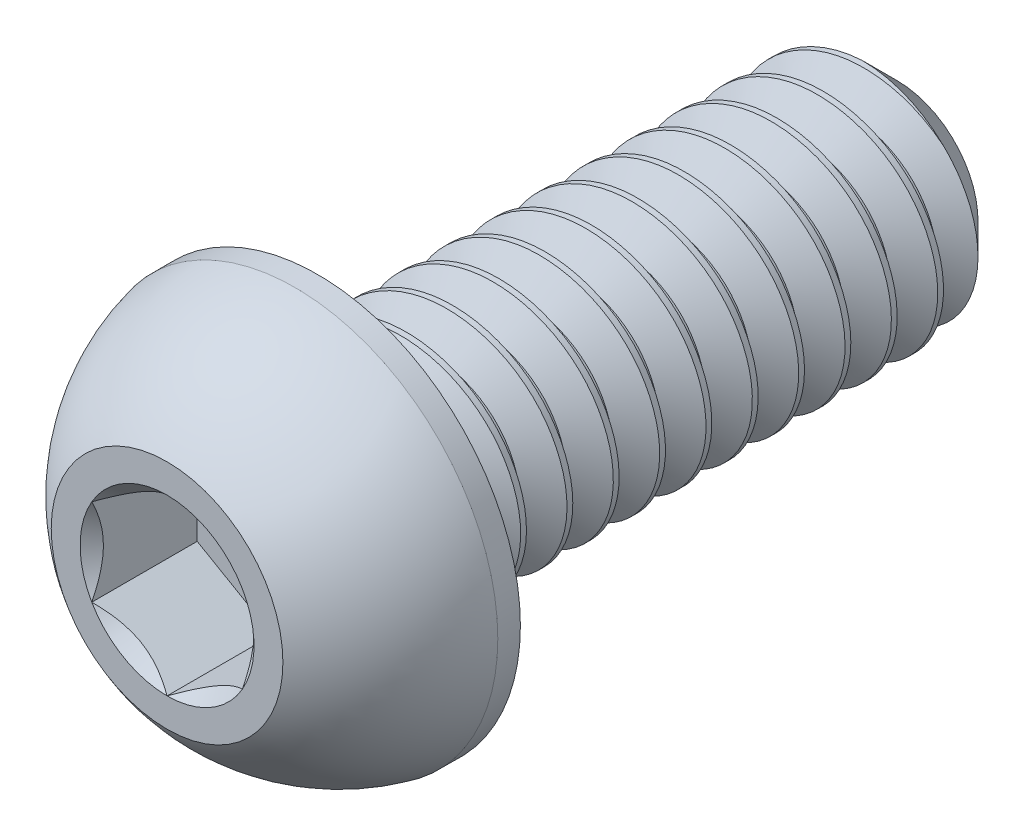
from build123d import *

# Parameters (mm, degrees)
SKETCH1_W          = 5
SKETCH1_H          = 1
CHAMFER1_SIZE      = 0.3
CUT_EXTRUDE2_DEPTH = 0.91
CUT_SWEEP1_PITCH   = 0.4
CUT_SWEEP1_TO      = 5


with BuildPart() as part:
    # Sketch1 → Revolve1 (revolve)
    with BuildSketch(Plane(origin=(0, 0, 0), x_dir=(0, 0, -1), z_dir=(1, 0, 0))):
        with Locations((3.8, 0.5)):
            Rectangle(SKETCH1_W, SKETCH1_H)
    revolve(axis=Axis((0, 0, -6.3), (0, 0, 1)))

    # Chamfer1
    chamfer1_edges = [part.edges().sort_by_distance(p)[0] for p in [
        (0, -1, -6.3),
    ]]
    chamfer(chamfer1_edges, length=CHAMFER1_SIZE)

    # Sketch7 → Revolve2 (revolve)
    with BuildSketch(Plane(origin=(0, 0, 0), x_dir=(0, 0, -1), z_dir=(1, 0, 0)), mode=Mode.PRIVATE) as revolve2_sk:
        with BuildLine():
            Line((1.105, 1.75), (1.3, 1.75))
            Line((1.3, 1.75), (1.3, 0))
            Line((1.3, 0), (0, 0))
            Line((0, 0), (0, 1))
            ThreePointArc((0, 1), (0.479976957, 1.481850617), (1.105, 1.75))
        make_face()
    revolve(revolve2_sk.sketch.rotate(Axis((0, 0, 0), (0, 0, -1)), 180), axis=Axis((0, 0, 0), (0, 0, -1)))

    # Sketch5 → Cut-Extrude2 (cut)
    with BuildSketch(Plane.XY):
        Polygon((0.65, -0.375277675), (0.65, 0.375277675), (0, 0.75055535), (-0.65, 0.375277675), (-0.65, -0.375277675), (0, -0.75055535), align=None)
    extrude(amount=-CUT_EXTRUDE2_DEPTH, mode=Mode.SUBTRACT)

    # Cut-Extrude3 cone 1 section (through the dimple's axis) → Cut-Extrude3 (revolve, cut)
    with BuildSketch(Plane(origin=(0, 0, 0), x_dir=(0, -1, 0), z_dir=(1, 0, 0))):
        Polygon((0, 0), (0.75055535, 0), (0, 0.75055535), align=None)
    revolve(axis=Axis((0, 0, 0), (0, 0, -1)), mode=Mode.SUBTRACT)

    # Cut-Sweep1: arcs per turn and ends read off the stored shape
    # Cut-Sweep1: the profile of Sketch2 profile screwed along a right-hand helix through 13 turns, 6 arcs to a turn; built about Z, then put on its axis
    cut_sweep1_z = Axis((0, 0, 0), (0, 0, 1))
    cut_sweep1_corners = [(1.0003, 0, 0.300173205), (1.0003, 0, -0.050173205), (0.740192379, 0, 0.1), (0.740192379, 0, 0.15)]
    with BuildLine(mode=Mode.PRIVATE) as cut_sweep1_profile:
        Line(cut_sweep1_corners[0], cut_sweep1_corners[1])
        Line(cut_sweep1_corners[1], cut_sweep1_corners[2])
        Line(cut_sweep1_corners[2], cut_sweep1_corners[3])
        Line(cut_sweep1_corners[3], cut_sweep1_corners[0])
    cut_sweep1_cap = Face(cut_sweep1_profile.wire())
    cut_sweep1_turn_angles = [0, 30, 60, 90, 120, 150, 180, 210, 240, 270, 300, 330, 360]
    cut_sweep1_turn_weights = [1, 0.8660254037844387, 1, 0.8660254037844387, 1, 0.8660254037844387, 1, 0.8660254037844387, 1, 0.8660254037844387, 1, 0.8660254037844387, 1]
    cut_sweep1_turn_rails = [Edge.make_bspline([Vector(p[0], p[1], 0).rotate(cut_sweep1_z, cut_sweep1_turn_angles[k]) / cut_sweep1_turn_weights[k] + Vector(0, 0, p[2] + CUT_SWEEP1_PITCH * cut_sweep1_turn_angles[k] / 360) for k in range(13)], [0, 0, 0, 1, 1, 2, 2, 3, 3, 4, 4, 5, 5, 6, 6, 6], 2, cut_sweep1_turn_weights) for p in cut_sweep1_corners]
    cut_sweep1_turn_sides = [Face.make_surface_from_curves(cut_sweep1_turn_rails[p[0]], cut_sweep1_turn_rails[p[1]]) for p in [(0, 1), (1, 2), (2, 3), (3, 0)]]
    cut_sweep1 = Plane(origin=(0, 0, -6.3), x_dir=(0, 1, 0), z_dir=(0, 0, 1)) * split(Solid(Shell([*[p.moved(Location((0, 0, CUT_SWEEP1_PITCH * i))) for i in range(13) for p in cut_sweep1_turn_sides], cut_sweep1_cap, cut_sweep1_cap.rotate(cut_sweep1_z, 4680).moved(Location((0, 0, CUT_SWEEP1_PITCH * 4680 / 360)))])), bisect_by=Plane.XY.offset(CUT_SWEEP1_TO), keep=Keep.BOTTOM, mode=Mode.PRIVATE)
    add(cut_sweep1, mode=Mode.SUBTRACT)


solid = part.part
